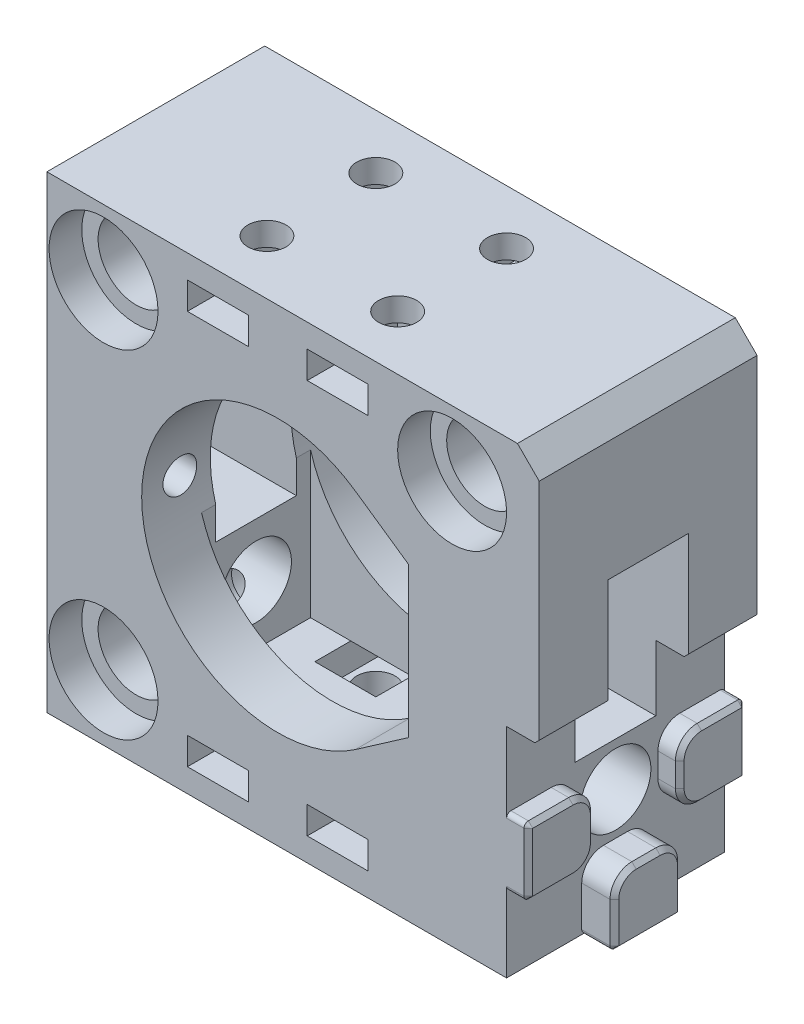
from build123d import *

# Parameters (mm, degrees)
EXTRUDE_1_DEPTH           = 10
EXTRUDE_1_DEPTH_BACK      = 10
SKETCH_1_W                = 46
SKETCH_1_H                = 43
CUT_EXTRUDE_1_DEPTH       = 38.924266638
SKETCH_3_R                = 5
CUT_EXTRUDE_2_DEPTH       = 3
SKETCH_4_R                = 3.5
CUT_EXTRUDE_3_DEPTH       = 3.5
SKETCH_5_R                = 1.75
CUT_EXTRUDE_4_DEPTH       = 35.935655139
MIRROR_6_COPY_1_SKETCH_R  = 5
MIRROR_6_COPY_1_DEPTH     = 3
MIRROR_6_COPY_2_SKETCH_R  = 3.5
MIRROR_6_COPY_2_DEPTH     = 3.5
MIRROR_7_COPY_1_SKETCH_R  = 5
MIRROR_7_COPY_1_DEPTH     = 3
MIRROR_7_COPY_2_SKETCH_R  = 3.5
MIRROR_7_COPY_2_DEPTH     = 3.5
SKETCH_7_W                = 5.6
SKETCH_7_H                = 2.5
CUT_EXTRUDE_7_DEPTH       = 8.3
CUT_EXTRUDE_6_REACH       = 52.249
SKETCH_8_R                = 1.75
MIRROR_4_COPY_1_SKETCH_W  = 5.6
MIRROR_4_COPY_1_SKETCH_H  = 2.5
MIRROR_4_COPY_1_DEPTH     = 8.3
MIRROR_4_COPY_2_REACH     = 52.249
MIRROR_4_COPY_2_SKETCH_R  = 1.75
MIRROR_5_COPY_1_SKETCH_W  = 5.6
MIRROR_5_COPY_1_SKETCH_H  = 2.5
MIRROR_5_COPY_1_DEPTH     = 8.3
MIRROR_5_COPY_2_REACH     = 52.249
MIRROR_5_COPY_2_SKETCH_R  = 1.75
MIRROR_5_COPY_3_SKETCH_W  = 5.6
MIRROR_5_COPY_3_SKETCH_H  = 2.5
MIRROR_5_COPY_3_DEPTH     = 8.3
MIRROR_5_COPY_4_REACH     = 52.249
MIRROR_5_COPY_4_SKETCH_R  = 1.75
MIRROR_5_COPY_5_SKETCH_W  = 5.6
MIRROR_5_COPY_5_SKETCH_H  = 2.5
MIRROR_5_COPY_5_DEPTH     = 8.3
MIRROR_5_COPY_6_REACH     = 52.249
MIRROR_5_COPY_6_SKETCH_R  = 1.75
SKETCH_9_R                = 3.25
CUT_EXTRUDE_8_DEPTH       = 52.751811562
CUT_EXTRUDE_9_REACH       = 53.752
CUT_EXTRUDE_9_END_RADIUS  = 12.5
SKETCH_10_W               = 7.4
SKETCH_10_H               = 13
CUT_EXTRUDE_10_REACH      = 53.752
SKETCH_11_W               = 7.4
SKETCH_11_H               = 16
SKETCH_13_W               = 3.1
SKETCH_13_H               = 5.6
CUT_EXTRUDE_11_DEPTH      = 8.3
CUT_EXTRUDE_12_REACH      = 53.752
CUT_EXTRUDE_12_END_RADIUS = 12.5
SKETCH_14_R               = 1.55
MIRROR_10_COPY_1_SKETCH_W = 3.1
MIRROR_10_COPY_1_SKETCH_H = 5.6
MIRROR_10_COPY_1_DEPTH    = 8.3
CHAMFER_1_SIZE            = 0.8
CHAMFER_2_SIZE            = 2
SKETCH_15_W               = 20
SKETCH_15_H               = 20
CUT_EXTRUDE_13_DEPTH      = 3
SKETCH_16_W               = 6.2
SKETCH_16_H               = 6.1
EXTRUDE_2_DEPTH           = 3
SKETCH_17_W               = 6.1
SKETCH_17_H               = 6.2
EXTRUDE_3_DEPTH           = 1
MIRROR_START              = -14.6
MIRROR_11_OUTLINE_W       = 2
MIRROR_11_OUTLINE_H       = 6.1
MIRROR_11_OUTLINE_W_2     = 1
MIRROR_11_DEPTH           = 6.2
CUT_EXTRUDE_START         = -9.351871
SKETCH_18_W               = 24
SKETCH_18_H               = 10
CUT_EXTRUDE_14_DEPTH      = 13.351871
FILLET_1_R                = 2
FILLET_2_R                = 0.4
CHAMFER_3_SIZE            = 0.4
CHAMFER_4_SIZE            = 0.4
CHAMFER_5_SIZE            = 0.8
CHAMFER_6_SIZE            = 0.4
CHAMFER_7_SIZE            = 0.4


# Read off the part's stored shape, not the designer's step: 镜向11
with BuildPart() as part:
    # 草图1 → 凸台-拉伸1 (new, two sides: drawn at the far end of the back side and taken through both)
    with BuildSketch(Plane.XY.offset(-EXTRUDE_1_DEPTH_BACK)):
        with Locations((1, 0)):
            Rectangle(SKETCH_1_W, SKETCH_1_H)
    extrude(amount=EXTRUDE_1_DEPTH + EXTRUDE_1_DEPTH_BACK)

    # 草图2 → 切除-拉伸1 (cut, through all)
    with BuildSketch(Plane.XY.offset(10)):
        with BuildLine():
            Line((12, 0), (12, 6.886387863))
            Line((12, 6.886387863), (7.128178115, 10.268353167))
            ThreePointArc((7.128178115, 10.268353167), (-12.5, 0), (7.128178115, -10.268353167))
            Line((7.128178115, -10.268353167), (12, -6.886387863))
            Line((12, -6.886387863), (12, 0))
        make_face()
    extrude(amount=-CUT_EXTRUDE_1_DEPTH, mode=Mode.SUBTRACT)

    # 草图3 → 切除-拉伸2 (cut)
    with BuildSketch(Plane.XY.offset(10)):
        with Locations((-16, 15.5)):
            Circle(SKETCH_3_R)
    cut_extrude_2 = extrude(amount=-CUT_EXTRUDE_2_DEPTH, mode=Mode.SUBTRACT)

    # 草图4 → 切除-拉伸3 (cut)
    with BuildSketch(Plane.XY.offset(7)):
        with Locations((-16, 15.5)):
            Circle(SKETCH_4_R)
    cut_extrude_3 = extrude(amount=-CUT_EXTRUDE_3_DEPTH, mode=Mode.SUBTRACT)

    # 草图5 → 切除-拉伸4 (cut, through all)
    with BuildSketch(Plane.XY.offset(3.5)):
        with Locations((-16, 15.5)):
            Circle(SKETCH_5_R)
    cut_extrude_4 = extrude(amount=-CUT_EXTRUDE_4_DEPTH, mode=Mode.SUBTRACT)

    # 镜向2: 切除-拉伸2, 切除-拉伸3 across plane
    add(cut_extrude_2.mirror(Plane.XY), mode=Mode.SUBTRACT)
    add(cut_extrude_3.mirror(Plane.XY), mode=Mode.SUBTRACT)

    # 镜向6: 切除-拉伸2, 切除-拉伸3, 切除-拉伸4 across plane
    add(cut_extrude_2.mirror(Plane(origin=(0, 0, 0), x_dir=(0, 0, 1), z_dir=(1, 0, 0))), mode=Mode.SUBTRACT)
    add(cut_extrude_3.mirror(Plane(origin=(0, 0, 0), x_dir=(0, 0, 1), z_dir=(1, 0, 0))), mode=Mode.SUBTRACT)
    add(cut_extrude_4.mirror(Plane(origin=(0, 0, 0), x_dir=(0, 0, 1), z_dir=(1, 0, 0))), mode=Mode.SUBTRACT)

    # 镜向6 copy 1 sketch → 镜向6 copy 1 (cut)
    with BuildSketch(Plane(origin=(0, 0, -10), x_dir=(-1, 0, 0), z_dir=(0, 0, -1))):
        with Locations((-16, 15.5)):
            Circle(MIRROR_6_COPY_1_SKETCH_R)
    extrude(amount=-MIRROR_6_COPY_1_DEPTH, mode=Mode.SUBTRACT)

    # 镜向6 copy 2 sketch → 镜向6 copy 2 (cut)
    with BuildSketch(Plane(origin=(0, 0, -7), x_dir=(-1, 0, 0), z_dir=(0, 0, -1))):
        with Locations((-16, 15.5)):
            Circle(MIRROR_6_COPY_2_SKETCH_R)
    extrude(amount=-MIRROR_6_COPY_2_DEPTH, mode=Mode.SUBTRACT)

    # 镜向7: 切除-拉伸2, 切除-拉伸3, 切除-拉伸4 across plane
    add(cut_extrude_2.mirror(Plane.ZX), mode=Mode.SUBTRACT)
    add(cut_extrude_3.mirror(Plane.ZX), mode=Mode.SUBTRACT)
    add(cut_extrude_4.mirror(Plane.ZX), mode=Mode.SUBTRACT)

    # 镜向7 copy 1 sketch → 镜向7 copy 1 (cut)
    with BuildSketch(Plane(origin=(0, 0, -10), x_dir=(1, 0, 0), z_dir=(0, 0, -1))):
        with Locations((-16, 15.5)):
            Circle(MIRROR_7_COPY_1_SKETCH_R)
    extrude(amount=-MIRROR_7_COPY_1_DEPTH, mode=Mode.SUBTRACT)

    # 镜向7 copy 2 sketch → 镜向7 copy 2 (cut)
    with BuildSketch(Plane(origin=(0, 0, -7), x_dir=(1, 0, 0), z_dir=(0, 0, -1))):
        with Locations((-16, 15.5)):
            Circle(MIRROR_7_COPY_2_SKETCH_R)
    extrude(amount=-MIRROR_7_COPY_2_DEPTH, mode=Mode.SUBTRACT)

    # 草图7 → 切除-拉伸7 (cut)
    with BuildSketch(Plane.XY.offset(10)):
        with Locations((-5.5, 18.101870862)):
            Rectangle(SKETCH_7_W, SKETCH_7_H)
    cut_extrude_7 = extrude(amount=-CUT_EXTRUDE_7_DEPTH, mode=Mode.SUBTRACT)

    # 草图8 → 切除-拉伸6 (cut, up to next)
    with BuildSketch(Plane(origin=(0, 21.5, 0), x_dir=(1, 0, 0), z_dir=(0, 1, 0)), mode=Mode.PRIVATE) as cut_extrude_6_sk1:
        with Locations(Location((-6, -5, 0), (0, 0, 270))):
            Circle(SKETCH_8_R)
    cut_extrude_6_tool1 = extrude(cut_extrude_6_sk1.sketch, amount=-CUT_EXTRUDE_6_REACH, mode=Mode.PRIVATE) & part.part
    cut_extrude_6 = cut_extrude_6_tool1.solids().sort_by_distance((-6, 21.5, 5))[0]
    add(cut_extrude_6, mode=Mode.SUBTRACT)

    # 镜向3: 切除-拉伸7, 切除-拉伸6 across plane
    add(cut_extrude_7.mirror(Plane(origin=(0, 0, 0), x_dir=(0, 0, 1), z_dir=(1, 0, 0))), mode=Mode.SUBTRACT)
    add(cut_extrude_6.mirror(Plane(origin=(0, 0, 0), x_dir=(0, 0, 1), z_dir=(1, 0, 0))), mode=Mode.SUBTRACT)

    # 镜向4: 切除-拉伸7, 切除-拉伸6 across plane
    add(cut_extrude_7.mirror(Plane.XY), mode=Mode.SUBTRACT)
    add(cut_extrude_6.mirror(Plane.XY), mode=Mode.SUBTRACT)

    # 镜向4 copy 1 sketch → 镜向4 copy 1 (cut)
    with BuildSketch(Plane(origin=(0, 0, -10), x_dir=(-1, 0, 0), z_dir=(0, 0, -1))):
        with Locations((-5.5, 18.101870862)):
            Rectangle(MIRROR_4_COPY_1_SKETCH_W, MIRROR_4_COPY_1_SKETCH_H)
    extrude(amount=-MIRROR_4_COPY_1_DEPTH, mode=Mode.SUBTRACT)

    # 镜向4 copy 2 sketch → 镜向4 copy 2 (cut, up to next)
    with BuildSketch(Plane(origin=(0, 21.5, 0), x_dir=(-1, 0, 0), z_dir=(0, 1, 0)), mode=Mode.PRIVATE) as mirror_4_copy_2_sk1:
        with Locations(Location((-6, -5, 0), (0, 0, 270))):
            Circle(MIRROR_4_COPY_2_SKETCH_R)
    mirror_4_copy_2_tool1 = extrude(mirror_4_copy_2_sk1.sketch, amount=-MIRROR_4_COPY_2_REACH, mode=Mode.PRIVATE) & part.part
    add(mirror_4_copy_2_tool1.solids().sort_by_distance((6, 21.5, -5))[0], mode=Mode.SUBTRACT)

    # 镜向5: 切除-拉伸7, 切除-拉伸6 across plane
    add(cut_extrude_7.mirror(Plane.ZX), mode=Mode.SUBTRACT)
    add(cut_extrude_6.mirror(Plane.ZX), mode=Mode.SUBTRACT)

    # 镜向5 copy 1 sketch → 镜向5 copy 1 (cut)
    with BuildSketch(Plane(origin=(0, 0, 10), x_dir=(-1, 0, 0), z_dir=(0, 0, 1))):
        with Locations((-5.5, 18.101870862)):
            Rectangle(MIRROR_5_COPY_1_SKETCH_W, MIRROR_5_COPY_1_SKETCH_H)
    extrude(amount=-MIRROR_5_COPY_1_DEPTH, mode=Mode.SUBTRACT)

    # 镜向5 copy 2 sketch → 镜向5 copy 2 (cut, up to next)
    with BuildSketch(Plane(origin=(0, -21.5, 0), x_dir=(-1, 0, 0), z_dir=(0, -1, 0)), mode=Mode.PRIVATE) as mirror_5_copy_2_sk1:
        with Locations(Location((-6, -5, 0), (0, 0, 270))):
            Circle(MIRROR_5_COPY_2_SKETCH_R)
    mirror_5_copy_2_tool1 = extrude(mirror_5_copy_2_sk1.sketch, amount=-MIRROR_5_COPY_2_REACH, mode=Mode.PRIVATE) & part.part
    add(mirror_5_copy_2_tool1.solids().sort_by_distance((6, -21.5, 5))[0], mode=Mode.SUBTRACT)

    # 镜向5 copy 3 sketch → 镜向5 copy 3 (cut)
    with BuildSketch(Plane(origin=(0, 0, -10), x_dir=(1, 0, 0), z_dir=(0, 0, -1))):
        with Locations((-5.5, 18.101870862)):
            Rectangle(MIRROR_5_COPY_3_SKETCH_W, MIRROR_5_COPY_3_SKETCH_H)
    extrude(amount=-MIRROR_5_COPY_3_DEPTH, mode=Mode.SUBTRACT)

    # 镜向5 copy 4 sketch → 镜向5 copy 4 (cut, up to next)
    with BuildSketch(Plane.XZ.offset(21.5), mode=Mode.PRIVATE) as mirror_5_copy_4_sk1:
        with Locations(Location((-6, -5, 0), (0, 0, 270))):
            Circle(MIRROR_5_COPY_4_SKETCH_R)
    mirror_5_copy_4_tool1 = extrude(mirror_5_copy_4_sk1.sketch, amount=-MIRROR_5_COPY_4_REACH, mode=Mode.PRIVATE) & part.part
    add(mirror_5_copy_4_tool1.solids().sort_by_distance((-6, -21.5, -5))[0], mode=Mode.SUBTRACT)

    # 镜向5 copy 5 sketch → 镜向5 copy 5 (cut)
    with BuildSketch(Plane(origin=(0, 0, -10), x_dir=(-1, 0, 0), z_dir=(0, 0, -1))):
        with Locations((-5.5, -18.101870862)):
            Rectangle(MIRROR_5_COPY_5_SKETCH_W, MIRROR_5_COPY_5_SKETCH_H)
    extrude(amount=-MIRROR_5_COPY_5_DEPTH, mode=Mode.SUBTRACT)

    # 镜向5 copy 6 sketch → 镜向5 copy 6 (cut, up to next)
    with BuildSketch(Plane(origin=(0, -21.5, 0), x_dir=(-1, 0, 0), z_dir=(0, -1, 0)), mode=Mode.PRIVATE) as mirror_5_copy_6_sk1:
        with Locations((-6, 5)):
            Circle(MIRROR_5_COPY_6_SKETCH_R)
    mirror_5_copy_6_tool1 = extrude(mirror_5_copy_6_sk1.sketch, amount=-MIRROR_5_COPY_6_REACH, mode=Mode.PRIVATE) & part.part
    add(mirror_5_copy_6_tool1.solids().sort_by_distance((6, -21.5, -5))[0], mode=Mode.SUBTRACT)

    # 草图9 → 切除-拉伸8 (cut, through all)
    with BuildSketch(Plane(origin=(24, 0, 0), x_dir=(0, 0, -1), z_dir=(1, 0, 0))):
        with Locations(Location((0, -11.5, 0), (0, 0, 90))):
            Circle(SKETCH_9_R)
    extrude(amount=-CUT_EXTRUDE_8_DEPTH, mode=Mode.SUBTRACT)

    # 切除-拉伸9: up to this cylinder (the profile starts outside it)
    cut_extrude_9_end = Plane(origin=(0, 0, 0), z_dir=(0, 0, 1)) * Cylinder(CUT_EXTRUDE_9_END_RADIUS, 133.504, mode=Mode.PRIVATE)
    # 草图10 → 切除-拉伸9 (cut, up to the surface)
    with BuildSketch(Plane.ZY.offset(22), mode=Mode.PRIVATE) as cut_extrude_9_sk1:
        Rectangle(SKETCH_10_W, SKETCH_10_H)
    cut_extrude_9_tool1 = extrude(cut_extrude_9_sk1.sketch, amount=-CUT_EXTRUDE_9_REACH, mode=Mode.PRIVATE) - cut_extrude_9_end
    add(cut_extrude_9_tool1.solids().sort_by_distance((-22, 0, 0))[0], mode=Mode.SUBTRACT)

    # 草图11 → 切除-拉伸10 (cut, up to next)
    with BuildSketch(Plane(origin=(24, 0, 0), x_dir=(0, 0, -1), z_dir=(1, 0, 0)), mode=Mode.PRIVATE) as cut_extrude_10_sk1:
        with Locations((0, 0.5)):
            Rectangle(SKETCH_11_W, SKETCH_11_H)
    cut_extrude_10_tool1 = extrude(cut_extrude_10_sk1.sketch, amount=-CUT_EXTRUDE_10_REACH, mode=Mode.PRIVATE) & part.part
    add(cut_extrude_10_tool1.solids().sort_by_distance((24, 0.5, 0))[0], mode=Mode.SUBTRACT)

    # 草图13 → 切除-拉伸11 (cut)
    with BuildSketch(Plane.ZY.offset(22)):
        with Locations((6.5, 5.5)):
            Rectangle(SKETCH_13_W, SKETCH_13_H)
    cut_extrude_11 = extrude(amount=-CUT_EXTRUDE_11_DEPTH, mode=Mode.SUBTRACT)

    # 镜向9: 切除-拉伸11 across plane
    add(cut_extrude_11.mirror(Plane.ZX), mode=Mode.SUBTRACT)

    # 切除-拉伸12: up to this cylinder (the profile starts outside it)
    cut_extrude_12_end = Plane(origin=(0, 0, 6.5), z_dir=(0, 0, 1)) * Cylinder(CUT_EXTRUDE_12_END_RADIUS, 133.504, mode=Mode.PRIVATE)
    # 草图14 → 切除-拉伸12 (cut, up to the surface)
    with BuildSketch(Plane.ZY.offset(22), mode=Mode.PRIVATE) as cut_extrude_12_sk1:
        with Locations((6.5, 0)):
            Circle(SKETCH_14_R)
    cut_extrude_12_tool1 = extrude(cut_extrude_12_sk1.sketch, amount=-CUT_EXTRUDE_12_REACH, mode=Mode.PRIVATE) - cut_extrude_12_end
    cut_extrude_12 = cut_extrude_12_tool1.solids().sort_by_distance((-22, 0, 6.5))[0]
    add(cut_extrude_12, mode=Mode.SUBTRACT)

    # 镜向10: 切除-拉伸11, 切除-拉伸12 across plane
    add(cut_extrude_11.mirror(Plane.XY), mode=Mode.SUBTRACT)
    add(cut_extrude_12.mirror(Plane.XY), mode=Mode.SUBTRACT)

    # 镜向10 copy 1 sketch → 镜向10 copy 1 (cut)
    with BuildSketch(Plane(origin=(-22, 0, 0), x_dir=(0, 0, -1), z_dir=(-1, 0, 0))):
        with Locations((6.5, 5.5)):
            Rectangle(MIRROR_10_COPY_1_SKETCH_W, MIRROR_10_COPY_1_SKETCH_H)
    extrude(amount=-MIRROR_10_COPY_1_DEPTH, mode=Mode.SUBTRACT)

    # 倒角1
    chamfer_1_edges = [part.edges().sort_by_distance(p)[0] for p in [
        (-22, -21.5, 0),
        (-22, 21.5, 0),
    ]]
    chamfer(chamfer_1_edges, length=CHAMFER_1_SIZE)

    # 倒角2
    chamfer_2_edges = [part.edges().sort_by_distance(p)[0] for p in [
        (24, 21.5, 0),
    ]]
    chamfer(chamfer_2_edges, length=CHAMFER_2_SIZE)

    # 草图15 → 切除-拉伸13 (cut)
    with BuildSketch(Plane(origin=(24, 0, 0), x_dir=(0, 0, -1), z_dir=(1, 0, 0))):
        with Locations((0, -11.5)):
            Rectangle(SKETCH_15_W, SKETCH_15_H)
    extrude(amount=-CUT_EXTRUDE_13_DEPTH, mode=Mode.SUBTRACT)

    # 草图16 → 凸台-拉伸2 (add)
    with BuildSketch(Plane(origin=(21, 0, 0), x_dir=(0, 0, -1), z_dir=(1, 0, 0))):
        with Locations((0, -18.45)):
            Rectangle(SKETCH_16_W, SKETCH_16_H)
    extrude(amount=EXTRUDE_2_DEPTH)

    # 草图17 → 凸台-拉伸3 (add)
    with BuildSketch(Plane(origin=(21, 0, 0), x_dir=(0, 0, -1), z_dir=(1, 0, 0))):
        with Locations((-6.95, -11.5)):
            Rectangle(SKETCH_17_W, SKETCH_17_H)
    extrude(amount=EXTRUDE_3_DEPTH)

    # 镜向11 outline → 镜向11 (add)
    with BuildSketch(Plane(origin=(0, 0, 0), x_dir=(1, 0, 0), z_dir=(0, 1, 0)).offset(MIRROR_START)):
        with Locations((22, 6.95)):
            Rectangle(MIRROR_11_OUTLINE_W, MIRROR_11_OUTLINE_H)
        with Locations((22.5, -6.95)):
            Rectangle(MIRROR_11_OUTLINE_W_2, MIRROR_11_OUTLINE_H)
    extrude(amount=MIRROR_11_DEPTH)

    # 草图18 → 切除-拉伸14 (cut)
    with BuildSketch(Plane(origin=(0, -7.5, 0), x_dir=(1, 0, 0), z_dir=(0, 1, 0)).offset(CUT_EXTRUDE_START)):
        Rectangle(SKETCH_18_W, SKETCH_18_H)
    extrude(amount=CUT_EXTRUDE_14_DEPTH, mode=Mode.SUBTRACT)

    # 圆角1
    fillet_1_edges = [part.edges().sort_by_distance(p)[0] for p in [
        (22.5, -15.4, -3.1),
        (22.5, -15.4, 3.1),
        (22, -14.6, 3.9),
        (22, -8.4, 3.9),
        (22, -8.4, -3.9),
        (22, -14.6, -3.9),
    ]]
    fillet(fillet_1_edges, radius=FILLET_1_R)

    # 圆角2
    fillet_2_edges = [part.edges().sort_by_distance(p)[0] for p in [
        (22.5, -21.5, -3.1),
        (22.5, -21.5, 3.1),
        (22, -8.4, 10),
        (22, -14.6, 10),
        (22, -14.6, -10),
        (22, -8.4, -10),
    ]]
    fillet(fillet_2_edges, radius=FILLET_2_R)

    # 倒角3
    chamfer_3_edges = [part.edges().sort_by_distance(p)[0] for p in [
        (23, -11.5, -3.9),
        (23, -8.4, -7.75),
        (23, -8.985786438, -4.485786438),
        (23, -14.014213562, -4.485786438),
        (24, -15.4, 0),
        (24, -19.25, 3.1),
        (24, -15.985786438, 2.514213562),
        (24, -15.985786438, -2.514213562),
        (23, -8.4, 7.75),
        (23, -11.5, 3.9),
        (23, -14.014213562, 4.485786438),
        (23, -8.985786438, 4.485786438),
        (23, -11.5, -10),
        (23, -14.6, -7.75),
        (23, -11.5, 10),
        (23, -14.6, 7.75),
        (24, -19.25, -3.1),
        (24, -21.5, 0),
    ]]
    chamfer(chamfer_3_edges, length=CHAMFER_3_SIZE - 0.0001)  # a hair under: the kernel refuses the full size

    # 倒角4
    chamfer_4_edges = [part.edges().sort_by_distance(p)[0] for p in [
        (24, -1.5, 6.85),
        (24, -1.5, -6.85),
    ]]
    chamfer(chamfer_4_edges, length=CHAMFER_4_SIZE)

    # 倒角5
    chamfer_5_edges = [part.edges().sort_by_distance(p)[0] for p in [
        (-22, 0, -10),
        (-22, 0, 10),
    ]]
    chamfer(chamfer_5_edges, length=CHAMFER_5_SIZE)

    # 倒角6
    chamfer_6_edges = [part.edges().sort_by_distance(p)[0] for p in [
        (-22, -14.75, 0),
        (-22, 0, 4.95),
        (-22, 0, -4.95),
    ]]
    chamfer(chamfer_6_edges, length=CHAMFER_6_SIZE)

    # 倒角7
    chamfer_7_edges = [part.edges().sort_by_distance(p)[0] for p in [
        (-22, 5.5, 8.05),
        (-22, 8.3, 6.5),
        (-22, 5.5, 4.95),
        (-22, 2.7, 6.5),
        (-22, -5.5, 8.05),
        (-22, -8.3, 6.5),
        (-22, -5.5, 4.95),
        (-22, -2.7, 6.5),
        (-22, -5.5, -8.05),
        (-22, -8.3, -6.5),
        (-22, -5.5, -4.95),
        (-22, -2.7, -6.5),
        (-22, 5.5, -8.05),
        (-22, 8.3, -6.5),
        (-22, 5.5, -4.95),
        (-22, 2.7, -6.5),
    ]]
    chamfer(chamfer_7_edges, length=CHAMFER_7_SIZE)


solid = part.part
